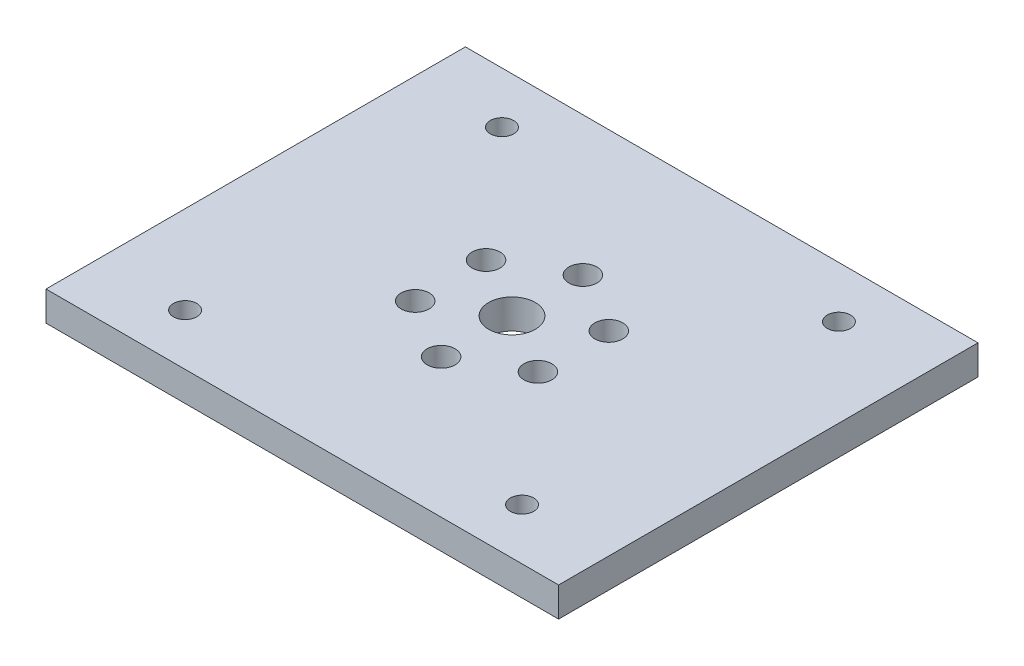
from build123d import *

# Parameters (mm, degrees)
SKETCH2_W            = 110
SKETCH2_H            = 90
BOSS_EXTRUDE1_DEPTH  = 6.35
SKETCH3_R            = 2.5
MOUNTING_HOLES_DEPTH = 143.268487375
CUT_EXTRUDE1_REACH   = 144.268
SKETCH5_R            = 3
SKETCH5_R_2          = 5


with BuildPart() as part:
    # Sketch2 → Boss-Extrude1 (new body)
    with BuildSketch(Plane(origin=(0, 0, 0), x_dir=(1, 0, 0), z_dir=(0, 1, 0))):
        with Locations((55, 45)):
            Rectangle(SKETCH2_W, SKETCH2_H)
    extrude(amount=BOSS_EXTRUDE1_DEPTH)

    # Sketch3 → Mounting Holes (cut, through all)
    with BuildSketch(Plane(origin=(0, 6.35, 0), x_dir=(1, 0, 0), z_dir=(0, 1, 0))):
        with Locations((18.85, 79)):
            Circle(SKETCH3_R)
        with Locations((18.85, 11)):
            Circle(SKETCH3_R)
        with Locations((91.15, 11)):
            Circle(SKETCH3_R)
        with Locations((91.15, 79)):
            Circle(SKETCH3_R)
    extrude(amount=-MOUNTING_HOLES_DEPTH, mode=Mode.SUBTRACT)

    # Sketch5 → Cut-Extrude1 (cut, up to next)
    with BuildSketch(Plane(origin=(0, 6.35, 0), x_dir=(1, 0, 0), z_dir=(0, 1, 0)), mode=Mode.PRIVATE) as cut_extrude1_sk1:
        with Locations((55, 60.21)):
            Circle(SKETCH5_R)
    cut_extrude1_tool1 = extrude(cut_extrude1_sk1.sketch, amount=-CUT_EXTRUDE1_REACH, mode=Mode.PRIVATE) & part.part
    # Sketch5 → Cut-Extrude1 (cut, up to next)
    with BuildSketch(Plane(origin=(0, 6.35, 0), x_dir=(1, 0, 0), z_dir=(0, 1, 0)), mode=Mode.PRIVATE) as cut_extrude1_sk2:
        with Locations((68.172246392, 52.605)):
            Circle(SKETCH5_R)
    cut_extrude1_tool2 = extrude(cut_extrude1_sk2.sketch, amount=-CUT_EXTRUDE1_REACH, mode=Mode.PRIVATE) & part.part
    # Sketch5 → Cut-Extrude1 (cut, up to next)
    with BuildSketch(Plane(origin=(0, 6.35, 0), x_dir=(1, 0, 0), z_dir=(0, 1, 0)), mode=Mode.PRIVATE) as cut_extrude1_sk3:
        with Locations((68.172246392, 37.395)):
            Circle(SKETCH5_R)
    cut_extrude1_tool3 = extrude(cut_extrude1_sk3.sketch, amount=-CUT_EXTRUDE1_REACH, mode=Mode.PRIVATE) & part.part
    # Sketch5 → Cut-Extrude1 (cut, up to next)
    with BuildSketch(Plane(origin=(0, 6.35, 0), x_dir=(1, 0, 0), z_dir=(0, 1, 0)), mode=Mode.PRIVATE) as cut_extrude1_sk4:
        with Locations((55, 29.79)):
            Circle(SKETCH5_R)
    cut_extrude1_tool4 = extrude(cut_extrude1_sk4.sketch, amount=-CUT_EXTRUDE1_REACH, mode=Mode.PRIVATE) & part.part
    # Sketch5 → Cut-Extrude1 (cut, up to next)
    with BuildSketch(Plane(origin=(0, 6.35, 0), x_dir=(1, 0, 0), z_dir=(0, 1, 0)), mode=Mode.PRIVATE) as cut_extrude1_sk5:
        with Locations((41.827753608, 37.395)):
            Circle(SKETCH5_R)
    cut_extrude1_tool5 = extrude(cut_extrude1_sk5.sketch, amount=-CUT_EXTRUDE1_REACH, mode=Mode.PRIVATE) & part.part
    # Sketch5 → Cut-Extrude1 (cut, up to next)
    with BuildSketch(Plane(origin=(0, 6.35, 0), x_dir=(1, 0, 0), z_dir=(0, 1, 0)), mode=Mode.PRIVATE) as cut_extrude1_sk6:
        with Locations((41.827753608, 52.605)):
            Circle(SKETCH5_R)
    cut_extrude1_tool6 = extrude(cut_extrude1_sk6.sketch, amount=-CUT_EXTRUDE1_REACH, mode=Mode.PRIVATE) & part.part
    # Sketch5 → Cut-Extrude1 (cut, up to next)
    with BuildSketch(Plane(origin=(0, 6.35, 0), x_dir=(1, 0, 0), z_dir=(0, 1, 0)), mode=Mode.PRIVATE) as cut_extrude1_sk7:
        with Locations((55, 45)):
            Circle(SKETCH5_R_2)
    cut_extrude1_tool7 = extrude(cut_extrude1_sk7.sketch, amount=-CUT_EXTRUDE1_REACH, mode=Mode.PRIVATE) & part.part
    add(cut_extrude1_tool1.solids().sort_by_distance((55, 6.35, -60.21))[0], mode=Mode.SUBTRACT)
    add(cut_extrude1_tool2.solids().sort_by_distance((68.172246, 6.35, -52.605))[0], mode=Mode.SUBTRACT)
    add(cut_extrude1_tool3.solids().sort_by_distance((68.172246, 6.35, -37.395))[0], mode=Mode.SUBTRACT)
    add(cut_extrude1_tool4.solids().sort_by_distance((55, 6.35, -29.79))[0], mode=Mode.SUBTRACT)
    add(cut_extrude1_tool5.solids().sort_by_distance((41.827754, 6.35, -37.395))[0], mode=Mode.SUBTRACT)
    add(cut_extrude1_tool6.solids().sort_by_distance((41.827754, 6.35, -52.605))[0], mode=Mode.SUBTRACT)
    add(cut_extrude1_tool7.solids().sort_by_distance((55, 6.35, -45))[0], mode=Mode.SUBTRACT)


solid = part.part
